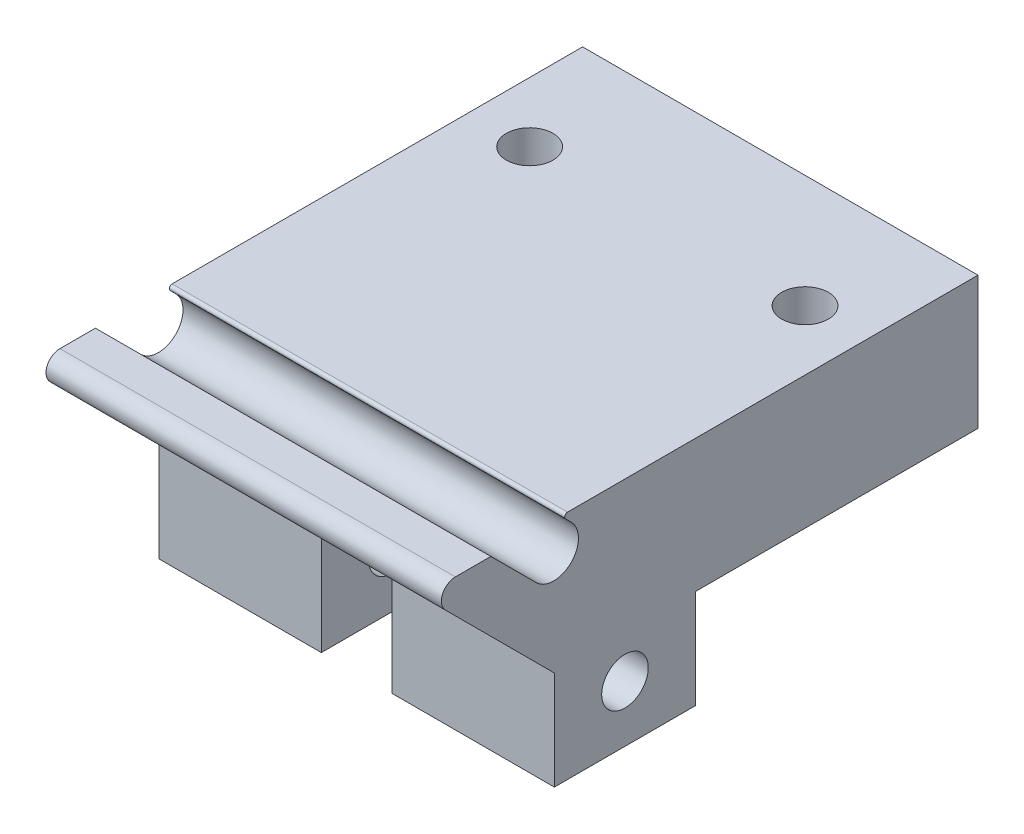
from build123d import *

# Parameters (mm, degrees)
SKETCH2_W             = 28
SKETCH2_H             = 9.398
BOSS_EXTRUDE1_DEPTH   = 30
M4X0_7_TAPPED_HOLE1_D = 3.3
SKETCH8_W             = 11.5
SKETCH8_H             = 10
BOSS_EXTRUDE2_DEPTH   = 7
M4X0_7_TAPPED_HOLE2_D = 3.3
SKETCH16_W            = 28
SKETCH16_H            = 9.398
BOSS_EXTRUDE3_DEPTH   = 8
CUT_EXTRUDE7_DEPTH    = 49.629894108
FILLET2_R             = 1.75
FILLET3_R             = 0.2
CHAMFER1_SIZE         = 8
FILLET4_R             = 0.988535


with BuildPart() as part:
    # Sketch2 → Boss-Extrude1 (new body)
    with BuildSketch(Plane.XY):
        Rectangle(SKETCH2_W, SKETCH2_H)
    extrude(amount=BOSS_EXTRUDE1_DEPTH)

    # M4x0.7 Tapped Hole1 (through all)
    with Locations(Plane(origin=(0, -4.699, 0), x_dir=(-1, 0, 0), z_dir=(0, -1, 0))):
        with Locations((-9.75, -8), (9.75, -8)):
            Hole(M4X0_7_TAPPED_HOLE1_D / 2)

    # Sketch8 → Boss-Extrude2 (add)
    with BuildSketch(Plane.XZ.offset(4.699)):
        with Locations((-8.25, 25)):
            Rectangle(SKETCH8_W, SKETCH8_H)
        with Locations((8.25, 25)):
            Rectangle(SKETCH8_W, SKETCH8_H)
    extrude(amount=BOSS_EXTRUDE2_DEPTH)

    # M4x0.7 Tapped Hole2 (through all)
    with Locations(Plane.ZY.offset(14)):
        with Locations((25, -7.699)):
            Hole(M4X0_7_TAPPED_HOLE2_D / 2)

    # Sketch16 → Boss-Extrude3 (add)
    with BuildSketch(Plane.XY.offset(30)):
        Rectangle(SKETCH16_W, SKETCH16_H)
    extrude(amount=BOSS_EXTRUDE3_DEPTH)

    # Sketch15 → Cut-Extrude7 (cut, through all)
    with BuildSketch(Plane.ZY.offset(14)):
        Polygon((34.5, 4.699), (30.045227279, 0.244227279), (27.570353544, 2.719101013), (29.550252532, 4.699), align=None)
    extrude(amount=-CUT_EXTRUDE7_DEPTH, mode=Mode.SUBTRACT)

    # Fillet2
    fillet2_edges = [part.edges().sort_by_distance(p)[0] for p in [
        (0, 0.244227279, 30.045227279),
        (0, 2.719101013, 27.570353544),
    ]]
    fillet(fillet2_edges, radius=FILLET2_R - 0.0001)  # a hair under: the kernel refuses the full size

    # Fillet3
    fillet3_edges = [part.edges().sort_by_distance(p)[0] for p in [
        (0, 4.699, 29.550252532),
    ]]
    fillet(fillet3_edges, radius=FILLET3_R)

    # Chamfer1
    chamfer1_edges = [part.edges().sort_by_distance(p)[0] for p in [
        (0, -4.699, 38),
    ]]
    chamfer(chamfer1_edges, length=CHAMFER1_SIZE)

    # Fillet4
    fillet4_edges = [part.edges().sort_by_distance(p)[0] for p in [
        (0, 3.301, 38),
        (0, 4.699, 38),
    ]]
    fillet(fillet4_edges, radius=FILLET4_R)


solid = part.part
